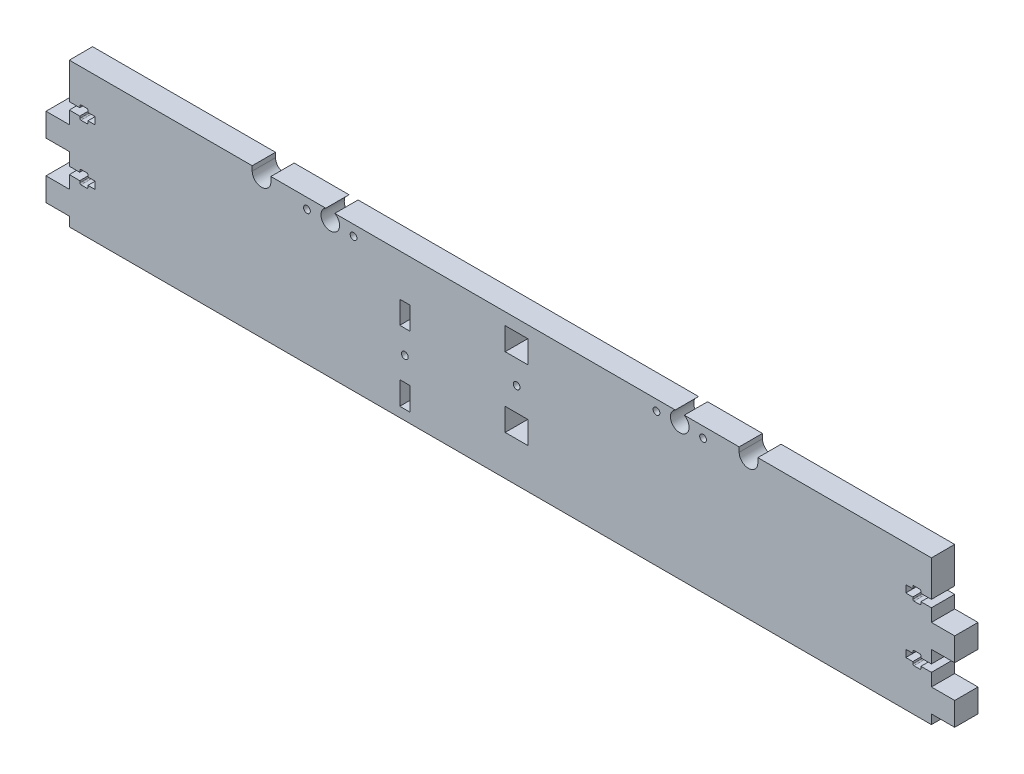
from build123d import *

# Parameters (mm, degrees)
MAINBODY_DEPTH      = 10
SCREWCUTOUTS_DEPTH  = 205.863369102
SKETCH2_R           = 4
SKETCH2_R_2         = 1.45
RODCUTOUTS_DEPTH    = 205.863369102
SKETCH4_R           = 1.45
SKETCH4_W           = 9.85
SKETCH4_H           = 9.7
CUT_EXTRUDE3_DEPTH  = 205.863369102
SKETCH5_R           = 1.45
SKETCH5_W           = 4.35
SKETCH5_H           = 9.7
SKETCH5_H_2         = 9.9
ENDSTOPHOLDER_DEPTH = 205.863369102
CUT_EXTRUDE4_DEPTH  = 205.863369102


with BuildPart() as part:
    # Sketch1 → MainBody (new body)
    with BuildSketch(Plane.XY):
        Polygon((0, 0), (-185, 0), (-185, -24), (-195, -24), (-195, -34), (-185, -34), (-185, -48), (-195, -48), (-195, -58), (-185, -58), (-185, -62), (0, -62), align=None)
    mainbody = extrude(amount=MAINBODY_DEPTH)

    # Sketch3 → ScrewCutouts (cut, through all)
    with BuildSketch(Plane.XY.offset(10)):
        with BuildLine():
            Line((-185, -18.55), (-180.5, -18.55))
            Line((-180.5, -18.55), (-180.5, -19.35))
            ThreePointArc((-180.5, -19.35), (-180.353553391, -19.703553391), (-180, -19.85))
            Line((-180, -19.85), (-177.5, -19.85))
            ThreePointArc((-177.5, -19.85), (-177.146446609, -19.703553391), (-177, -19.35))
            Line((-177, -19.35), (-177, -18.55))
            Line((-177, -18.55), (-174, -18.55))
            Line((-174, -18.55), (-174, -15.45))
            Line((-174, -15.45), (-177, -15.45))
            Line((-177, -15.45), (-177, -14.65))
            ThreePointArc((-177, -14.65), (-177.146446609, -14.296446609), (-177.5, -14.15))
            Line((-177.5, -14.15), (-180, -14.15))
            ThreePointArc((-180, -14.15), (-180.353553391, -14.296446609), (-180.5, -14.65))
            Line((-180.5, -14.65), (-180.5, -15.45))
            Line((-180.5, -15.45), (-185, -15.45))
            Line((-185, -15.45), (-185, -18.55))
        make_face()
        with BuildLine():
            Line((-185, -39.45), (-185, -42.55))
            Line((-185, -42.55), (-180.5, -42.55))
            Line((-180.5, -42.55), (-180.5, -43.35))
            ThreePointArc((-180.5, -43.35), (-180.353553391, -43.703553391), (-180, -43.85))
            Line((-180, -43.85), (-177.5, -43.85))
            ThreePointArc((-177.5, -43.85), (-177.146446609, -43.703553391), (-177, -43.35))
            Line((-177, -43.35), (-177, -42.55))
            Line((-177, -42.55), (-174, -42.55))
            Line((-174, -42.55), (-174, -39.45))
            Line((-174, -39.45), (-177, -39.45))
            Line((-177, -39.45), (-177, -38.65))
            ThreePointArc((-177, -38.65), (-177.146446609, -38.296446609), (-177.5, -38.15))
            Line((-177.5, -38.15), (-180, -38.15))
            ThreePointArc((-180, -38.15), (-180.353553391, -38.296446609), (-180.5, -38.65))
            Line((-180.5, -38.65), (-180.5, -39.45))
            Line((-180.5, -39.45), (-185, -39.45))
        make_face()
    screwcutouts = extrude(amount=-SCREWCUTOUTS_DEPTH, mode=Mode.SUBTRACT)

    # Mirror1: MainBody, ScrewCutouts across plane
    add(mainbody.mirror(Plane(origin=(0, 0, 0), x_dir=(0, 0, 1), z_dir=(1, 0, 0))))
    add(screwcutouts.mirror(Plane(origin=(0, 0, 0), x_dir=(0, 0, 1), z_dir=(1, 0, 0))), mode=Mode.SUBTRACT)

    # Sketch2 → RodCutouts (cut, through all)
    with BuildSketch(Plane.XY.offset(10)):
        with Locations((-73, -3.5)):
            Circle(SKETCH2_R)
        with Locations((-83, -4.5)):
            Circle(SKETCH2_R_2)
        with Locations((-63, -4.5)):
            Circle(SKETCH2_R_2)
        with Locations((67, -4.5)):
            Circle(SKETCH2_R_2)
        with Locations((87, -4.5)):
            Circle(SKETCH2_R_2)
        with Locations((77, -3.5)):
            Circle(SKETCH2_R)
    extrude(amount=-RODCUTOUTS_DEPTH, mode=Mode.SUBTRACT)

    # Sketch4 → Cut-Extrude3 (cut, through all)
    with BuildSketch(Plane.XY.offset(10)):
        with Locations((7, -25)):
            Circle(SKETCH4_R)
        with Locations((7, -10)):
            Rectangle(SKETCH4_W, SKETCH4_H)
        with Locations((7, -40)):
            Rectangle(SKETCH4_W, SKETCH4_H)
    extrude(amount=-CUT_EXTRUDE3_DEPTH, mode=Mode.SUBTRACT)

    # Sketch5 → EndstopHolder (cut, through all)
    with BuildSketch(Plane.XY.offset(10)):
        with Locations((-41, -37.75)):
            Circle(SKETCH5_R)
        with Locations((-41, -22.8)):
            Rectangle(SKETCH5_W, SKETCH5_H)
        with Locations((-41, -52.8)):
            Rectangle(SKETCH5_W, SKETCH5_H_2)
        with BuildLine():
            Line((-31.425, 8.994431211), (-31.425, 5))
            ThreePointArc((-31.425, 5), (-34.625, 1.8), (-37.825, 5))
            Line((-37.825, 5), (-37.825, 8.994431211))
            ThreePointArc((-37.825, 8.994431211), (-34.625, 12.194431211), (-31.425, 8.994431211))
        make_face()
    extrude(amount=-ENDSTOPHOLDER_DEPTH, mode=Mode.SUBTRACT)

    # Sketch7 → Cut-Extrude4 (cut, through all)
    with BuildSketch(Plane.XY.offset(10)):
        with BuildLine():
            Line((-98.5, 0), (-98.5, -2))
            ThreePointArc((-98.5, -2), (-102.5, -6), (-106.5, -2))
            Line((-106.5, -2), (-106.5, 0))
            ThreePointArc((-106.5, 0), (-102.5, 4), (-98.5, 0))
        make_face()
        with BuildLine():
            Line((102.5, 0), (102.5, -2))
            ThreePointArc((102.5, -2), (106.5, -6), (110.5, -2))
            Line((110.5, -2), (110.5, 0))
            ThreePointArc((110.5, 0), (106.5, 4), (102.5, 0))
        make_face()
    extrude(amount=-CUT_EXTRUDE4_DEPTH, mode=Mode.SUBTRACT)


solid = part.part
